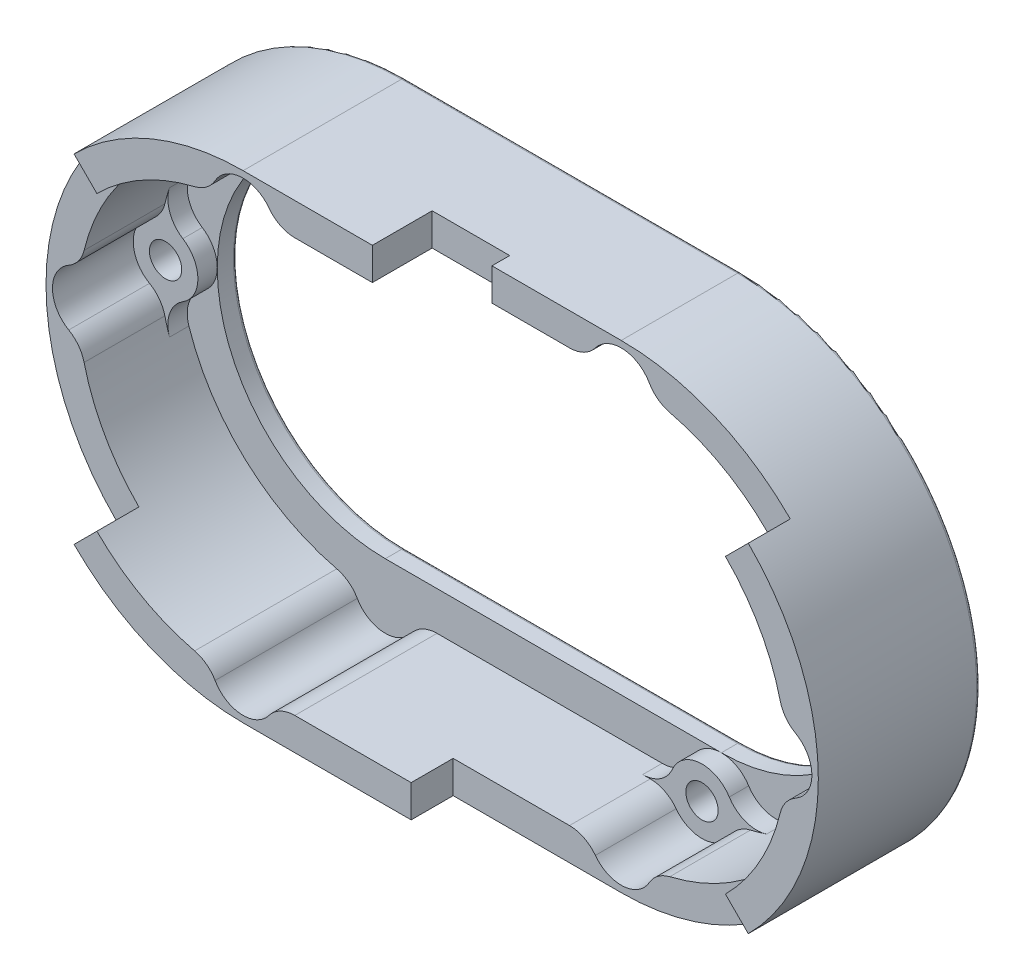
from build123d import *

# Parameters (mm, degrees)
BOSS_EXTRUDE1_DEPTH = 25
SKETCH1_3_R         = 5
BOSS_EXTRUDE2_DEPTH = 3
SKETCH2_W           = 12
SKETCH2_H           = 18.5
CUT_EXTRUDE1_DEPTH  = 5
BOSS_EXTRUDE3_START = 3
SKETCH1_4_R         = 5
SKETCH1_4_R_2       = 2.5
BOSS_EXTRUDE3_DEPTH = 3
FILLET2_R           = 5
FILLET3_R           = 5
FILLET1_R           = 0.5
CUT_EXTRUDE3_START  = 1.5
SKETCH1_6_R         = 2.5
CUT_EXTRUDE3_DEPTH  = 1.5
CUT_EXTRUDE4_START  = -6.5
CUT_EXTRUDE4_DEPTH  = 6.5


with BuildPart() as part:
    # Sketch1 → Boss-Extrude1 (new body)
    with BuildSketch(Plane.XY):
        with BuildLine():
            Line((52, 37), (0, 37))
            ThreePointArc((0, 37), (-37, 0), (0, -37))
            Line((0, -37), (52, -37))
            ThreePointArc((52, -37), (89, 0), (52, 37))
        make_face()
        with BuildLine():
            ThreePointArc((-31.612903226, 4.96229278), (-22.627416998, 22.627416998), (-4.96229278, 31.612903226))
            ThreePointArc((-4.96229278, 31.612903226), (-0.196120171, 35.996152207), (4.898979486, 32))
            Line((4.898979486, 32), (47.101020514, 32))
            ThreePointArc((47.101020514, 32), (52.196120171, 35.996152207), (56.96229278, 31.612903226))
            ThreePointArc((56.96229278, 31.612903226), (74.627416998, 22.627416998), (83.612903226, 4.96229278))
            ThreePointArc((83.612903226, 4.96229278), (86.745965572, 3.311758134), (88, 0))
            ThreePointArc((88, 0), (86.745965572, -3.311758134), (83.612903226, -4.96229278))
            ThreePointArc((83.612903226, -4.96229278), (74.627416998, -22.627416998), (56.96229278, -31.612903226))
            ThreePointArc((56.96229278, -31.612903226), (52.196120171, -35.996152207), (47.101020514, -32))
            Line((47.101020514, -32), (4.898979486, -32))
            ThreePointArc((4.898979486, -32), (-0.196120171, -35.996152207), (-4.96229278, -31.612903226))
            ThreePointArc((-4.96229278, -31.612903226), (-22.627416998, -22.627416998), (-31.612903226, -4.96229278))
            ThreePointArc((-31.612903226, -4.96229278), (-36, 0), (-31.612903226, 4.96229278))
        make_face(mode=Mode.SUBTRACT)
    extrude(amount=BOSS_EXTRUDE1_DEPTH)

    # Sketch1<3> → Boss-Extrude2 (add)
    # profile 1 of 43: a face of its own
    with BuildSketch(Plane.XY):
        with BuildLine():
            Line((0, -37), (52, -37))
            ThreePointArc((52, -37), (89, 0), (52, 37))
            Line((52, 37), (0, 37))
            ThreePointArc((0, 37), (-37, 0), (0, -37))
        make_face()
        with Locations((0, 31)):
            Circle(SKETCH1_3_R, mode=Mode.SUBTRACT)
        with Locations((52, 31)):
            Circle(SKETCH1_3_R, mode=Mode.SUBTRACT)
        with Locations((83, 0)):
            Circle(SKETCH1_3_R, mode=Mode.SUBTRACT)
        with Locations((52, -31)):
            Circle(SKETCH1_3_R, mode=Mode.SUBTRACT)
        with Locations((0, -31)):
            Circle(SKETCH1_3_R, mode=Mode.SUBTRACT)
        with Locations((-31, 0)):
            Circle(SKETCH1_3_R, mode=Mode.SUBTRACT)
        with BuildLine():
            Line((0, 32), (52, 32))
            ThreePointArc((52, 32), (84, 0), (52, -32))
            Line((52, -32), (0, -32))
            ThreePointArc((0, -32), (-32, 0), (0, 32))
        make_face(mode=Mode.SUBTRACT)
    # profile 2 of 43: a face of its own
    with BuildSketch(Plane.XY):
        with BuildLine():
            Line((52, 32), (49.708712153, 32))
            ThreePointArc((49.708712153, 32), (51.489225891, 28.552734218), (54.5, 31))
            ThreePointArc((54.5, 31), (54.456219207, 31.465818858), (54.326410233, 31.915322581))
            ThreePointArc((54.326410233, 31.915322581), (53.16397539, 31.978823638), (52, 32))
        make_face()
    # profile 3 of 43: a face of its own
    with BuildSketch(Plane.XY):
        with BuildLine():
            ThreePointArc((54.326410233, 31.915322581), (52.04583625, 33.499579772), (49.708712153, 32))
            Line((49.708712153, 32), (52, 32))
            ThreePointArc((52, 32), (53.16397539, 31.978823638), (54.326410233, 31.915322581))
        make_face()
    # profile 4 of 43: a face of its own
    with BuildSketch(Plane.XY):
        with BuildLine():
            ThreePointArc((56.96229278, 31.612903226), (52.196120171, 35.996152207), (47.101020514, 32))
            Line((47.101020514, 32), (49.708712153, 32))
            ThreePointArc((49.708712153, 32), (52.04583625, 33.499579772), (54.326410233, 31.915322581))
            ThreePointArc((54.326410233, 31.915322581), (55.647487117, 31.791442838), (56.96229278, 31.612903226))
        make_face()
    # profile 5 of 43: a face of its own
    with BuildSketch(Plane.XY):
        with BuildLine():
            ThreePointArc((47.101020514, 32), (48.127016654, 27.83772234), (52, 26))
            ThreePointArc((52, 26), (55.535533906, 27.464466094), (57, 31))
            ThreePointArc((57, 31), (56.990564292, 31.307031024), (56.96229278, 31.612903226))
            ThreePointArc((56.96229278, 31.612903226), (55.647487117, 31.791442838), (54.326410233, 31.915322581))
            ThreePointArc((54.326410233, 31.915322581), (54.456219207, 31.465818858), (54.5, 31))
            ThreePointArc((54.5, 31), (51.489225891, 28.552734218), (49.708712153, 32))
            Line((49.708712153, 32), (47.101020514, 32))
        make_face()
    # profile 6 of 43: a face of its own
    with BuildSketch(Plane.XY):
        with BuildLine():
            Line((52, 32), (49.708712153, 32))
            ThreePointArc((49.708712153, 32), (51.489225891, 28.552734218), (54.5, 31))
            ThreePointArc((54.5, 31), (54.456219207, 31.465818858), (54.326410233, 31.915322581))
            ThreePointArc((54.326410233, 31.915322581), (53.16397539, 31.978823638), (52, 32))
        make_face()
    # profile 7 of 43: a face of its own
    with BuildSketch(Plane.XY):
        with BuildLine():
            ThreePointArc((54.326410233, 31.915322581), (52.04583625, 33.499579772), (49.708712153, 32))
            Line((49.708712153, 32), (52, 32))
            ThreePointArc((52, 32), (53.16397539, 31.978823638), (54.326410233, 31.915322581))
        make_face()
    # profile 8 of 43: a face of its own
    with BuildSketch(Plane.XY):
        with BuildLine():
            ThreePointArc((56.96229278, 31.612903226), (52.196120171, 35.996152207), (47.101020514, 32))
            Line((47.101020514, 32), (49.708712153, 32))
            ThreePointArc((49.708712153, 32), (52.04583625, 33.499579772), (54.326410233, 31.915322581))
            ThreePointArc((54.326410233, 31.915322581), (55.647487117, 31.791442838), (56.96229278, 31.612903226))
        make_face()
    # profile 9 of 43: a face of its own
    with BuildSketch(Plane.XY):
        with BuildLine():
            ThreePointArc((47.101020514, 32), (48.127016654, 27.83772234), (52, 26))
            ThreePointArc((52, 26), (55.535533906, 27.464466094), (57, 31))
            ThreePointArc((57, 31), (56.990564292, 31.307031024), (56.96229278, 31.612903226))
            ThreePointArc((56.96229278, 31.612903226), (55.647487117, 31.791442838), (54.326410233, 31.915322581))
            ThreePointArc((54.326410233, 31.915322581), (54.456219207, 31.465818858), (54.5, 31))
            ThreePointArc((54.5, 31), (51.489225891, 28.552734218), (49.708712153, 32))
            Line((49.708712153, 32), (47.101020514, 32))
        make_face()
    # profile 10 of 43: a face of its own
    with BuildSketch(Plane.XY):
        with BuildLine():
            ThreePointArc((57, 31), (55.535533906, 27.464466094), (52, 26))
            ThreePointArc((52, 26), (70.384776311, 18.384776311), (78, 0))
            ThreePointArc((78, 0), (79.688241866, 3.745965572), (83.612903226, 4.96229278))
            ThreePointArc((83.612903226, 4.96229278), (74.627416998, 22.627416998), (56.96229278, 31.612903226))
            ThreePointArc((56.96229278, 31.612903226), (56.990564292, 31.307031024), (57, 31))
        make_face()
    # profile 11 of 43: a face of its own
    with BuildSketch(Plane.XY):
        with BuildLine():
            ThreePointArc((88, 0), (86.745965572, 3.311758134), (83.612903226, 4.96229278))
            ThreePointArc((83.612903226, 4.96229278), (84, 0), (83.612903226, -4.96229278))
            ThreePointArc((83.612903226, -4.96229278), (86.745965572, -3.311758134), (88, 0))
        make_face()
    # profile 12 of 43: a face of its own
    with BuildSketch(Plane.XY):
        with BuildLine():
            ThreePointArc((83.612903226, 4.96229278), (79.688241866, 3.745965572), (78, 0))
            ThreePointArc((78, 0), (79.688241866, -3.745965572), (83.612903226, -4.96229278))
            ThreePointArc((83.612903226, -4.96229278), (84, 0), (83.612903226, 4.96229278))
        make_face()
    # profile 13 of 43: a face of its own
    with BuildSketch(Plane.XY):
        with BuildLine():
            ThreePointArc((83.612903226, -4.96229278), (79.688241866, -3.745965572), (78, 0))
            ThreePointArc((78, 0), (70.384776311, -18.384776311), (52, -26))
            ThreePointArc((52, -26), (55.535533906, -27.464466094), (57, -31))
            ThreePointArc((57, -31), (56.990564292, -31.307031024), (56.96229278, -31.612903226))
            ThreePointArc((56.96229278, -31.612903226), (74.627416998, -22.627416998), (83.612903226, -4.96229278))
        make_face()
    # profile 14 of 43: a face of its own
    with BuildSketch(Plane.XY):
        with BuildLine():
            Line((49.708712153, -32), (47.101020514, -32))
            ThreePointArc((47.101020514, -32), (52.196120171, -35.996152207), (56.96229278, -31.612903226))
            ThreePointArc((56.96229278, -31.612903226), (55.647487117, -31.791442838), (54.326410233, -31.915322581))
            ThreePointArc((54.326410233, -31.915322581), (52.04583625, -33.499579772), (49.708712153, -32))
        make_face()
    # profile 15 of 43: a face of its own
    with BuildSketch(Plane.XY):
        with BuildLine():
            ThreePointArc((57, -31), (55.535533906, -27.464466094), (52, -26))
            ThreePointArc((52, -26), (48.127016654, -27.83772234), (47.101020514, -32))
            Line((47.101020514, -32), (49.708712153, -32))
            ThreePointArc((49.708712153, -32), (51.489225891, -28.552734218), (54.5, -31))
            ThreePointArc((54.5, -31), (54.456219207, -31.465818858), (54.326410233, -31.915322581))
            ThreePointArc((54.326410233, -31.915322581), (55.647487117, -31.791442838), (56.96229278, -31.612903226))
            ThreePointArc((56.96229278, -31.612903226), (56.990564292, -31.307031024), (57, -31))
        make_face()
    # profile 16 of 43: a face of its own
    with BuildSketch(Plane.XY):
        with BuildLine():
            Line((52, -32), (49.708712153, -32))
            ThreePointArc((49.708712153, -32), (52.04583625, -33.499579772), (54.326410233, -31.915322581))
            ThreePointArc((54.326410233, -31.915322581), (53.16397539, -31.978823638), (52, -32))
        make_face()
    # profile 17 of 43: a face of its own
    with BuildSketch(Plane.XY):
        with BuildLine():
            ThreePointArc((54.5, -31), (51.489225891, -28.552734218), (49.708712153, -32))
            Line((49.708712153, -32), (52, -32))
            ThreePointArc((52, -32), (53.16397539, -31.978823638), (54.326410233, -31.915322581))
            ThreePointArc((54.326410233, -31.915322581), (54.456219207, -31.465818858), (54.5, -31))
        make_face()
    # profile 18 of 43: a face of its own
    with BuildSketch(Plane.XY):
        with BuildLine():
            Line((52, -26), (0, -26))
            ThreePointArc((0, -26), (3.535533906, -27.464466094), (5, -31))
            ThreePointArc((5, -31), (4.974680765, -31.50254481), (4.898979486, -32))
            Line((4.898979486, -32), (47.101020514, -32))
            ThreePointArc((47.101020514, -32), (48.127016654, -27.83772234), (52, -26))
        make_face()
    # profile 19 of 43: a face of its own
    with BuildSketch(Plane.XY):
        with BuildLine():
            ThreePointArc((0, -32), (-2.488684067, -31.90307903), (-4.96229278, -31.612903226))
            ThreePointArc((-4.96229278, -31.612903226), (-0.196120171, -35.996152207), (4.898979486, -32))
            Line((4.898979486, -32), (0, -32))
        make_face()
    # profile 20 of 43: a face of its own
    with BuildSketch(Plane.XY):
        with BuildLine():
            ThreePointArc((5, -31), (3.535533906, -27.464466094), (0, -26))
            ThreePointArc((0, -26), (-3.745965572, -27.688241866), (-4.96229278, -31.612903226))
            ThreePointArc((-4.96229278, -31.612903226), (-2.488684067, -31.90307903), (0, -32))
            Line((0, -32), (4.898979486, -32))
            ThreePointArc((4.898979486, -32), (4.974680765, -31.50254481), (5, -31))
        make_face()
    # profile 21 of 43: a face of its own
    with BuildSketch(Plane.XY):
        with BuildLine():
            ThreePointArc((0, -26), (-18.384776311, -18.384776311), (-26, 0))
            ThreePointArc((-26, 0), (-27.688241866, -3.745965572), (-31.612903226, -4.96229278))
            ThreePointArc((-31.612903226, -4.96229278), (-22.627416998, -22.627416998), (-4.96229278, -31.612903226))
            ThreePointArc((-4.96229278, -31.612903226), (-3.745965572, -27.688241866), (0, -26))
        make_face()
    # profile 22 of 43: a face of its own
    with BuildSketch(Plane.XY):
        with BuildLine():
            ThreePointArc((-31.915322581, -2.326410233), (-32, 0), (-31.915322581, 2.326410233))
            ThreePointArc((-31.915322581, 2.326410233), (-33.5, 0), (-31.915322581, -2.326410233))
        make_face()
    # profile 23 of 43: a face of its own
    with BuildSketch(Plane.XY):
        with BuildLine():
            ThreePointArc((-28.5, 0), (-29.592574416, 2.06619293), (-31.915322581, 2.326410233))
            ThreePointArc((-31.915322581, 2.326410233), (-32, 0), (-31.915322581, -2.326410233))
            ThreePointArc((-31.915322581, -2.326410233), (-29.592574416, -2.06619293), (-28.5, 0))
        make_face()
    # profile 24 of 43: a face of its own
    with BuildSketch(Plane.XY):
        with BuildLine():
            ThreePointArc((-31.915322581, 2.326410233), (-31.791442838, 3.647487117), (-31.612903226, 4.96229278))
            ThreePointArc((-31.612903226, 4.96229278), (-36, 0), (-31.612903226, -4.96229278))
            ThreePointArc((-31.612903226, -4.96229278), (-31.791442838, -3.647487117), (-31.915322581, -2.326410233))
            ThreePointArc((-31.915322581, -2.326410233), (-33.5, 0), (-31.915322581, 2.326410233))
        make_face()
    # profile 25 of 43: a face of its own
    with BuildSketch(Plane.XY):
        with BuildLine():
            ThreePointArc((-31.612903226, -4.96229278), (-27.688241866, -3.745965572), (-26, 0))
            ThreePointArc((-26, 0), (-27.688241866, 3.745965572), (-31.612903226, 4.96229278))
            ThreePointArc((-31.612903226, 4.96229278), (-31.791442838, 3.647487117), (-31.915322581, 2.326410233))
            ThreePointArc((-31.915322581, 2.326410233), (-29.592574416, 2.06619293), (-28.5, 0))
            ThreePointArc((-28.5, 0), (-29.592574416, -2.06619293), (-31.915322581, -2.326410233))
            ThreePointArc((-31.915322581, -2.326410233), (-31.791442838, -3.647487117), (-31.612903226, -4.96229278))
        make_face()
    # profile 26 of 43: a face of its own
    with BuildSketch(Plane.XY):
        with BuildLine():
            ThreePointArc((-26, 0), (-18.384776311, 18.384776311), (0, 26))
            ThreePointArc((0, 26), (-3.745965572, 27.688241866), (-4.96229278, 31.612903226))
            ThreePointArc((-4.96229278, 31.612903226), (-22.627416998, 22.627416998), (-31.612903226, 4.96229278))
            ThreePointArc((-31.612903226, 4.96229278), (-27.688241866, 3.745965572), (-26, 0))
        make_face()
    # profile 27 of 43: a face of its own
    with BuildSketch(Plane.XY):
        with BuildLine():
            ThreePointArc((4.898979486, 32), (-0.196120171, 35.996152207), (-4.96229278, 31.612903226))
            ThreePointArc((-4.96229278, 31.612903226), (-2.488684067, 31.90307903), (0, 32))
            Line((0, 32), (4.898979486, 32))
        make_face()
    # profile 28 of 43: a face of its own
    with BuildSketch(Plane.XY):
        with BuildLine():
            ThreePointArc((-4.96229278, 31.612903226), (-3.745965572, 27.688241866), (0, 26))
            ThreePointArc((0, 26), (3.535533906, 27.464466094), (5, 31))
            ThreePointArc((5, 31), (4.974680765, 31.50254481), (4.898979486, 32))
            Line((4.898979486, 32), (0, 32))
            ThreePointArc((0, 32), (-2.488684067, 31.90307903), (-4.96229278, 31.612903226))
        make_face()
    # profile 29 of 43: a face of its own
    with BuildSketch(Plane.XY):
        with BuildLine():
            ThreePointArc((5, 31), (3.535533906, 27.464466094), (0, 26))
            Line((0, 26), (52, 26))
            ThreePointArc((52, 26), (48.127016654, 27.83772234), (47.101020514, 32))
            Line((47.101020514, 32), (4.898979486, 32))
            ThreePointArc((4.898979486, 32), (4.974680765, 31.50254481), (5, 31))
        make_face()
    # profile 30 of 43: a face of its own
    with BuildSketch(Plane.XY):
        with BuildLine():
            ThreePointArc((-4.96229278, 31.612903226), (-3.745965572, 27.688241866), (0, 26))
            ThreePointArc((0, 26), (3.535533906, 27.464466094), (5, 31))
            ThreePointArc((5, 31), (4.974680765, 31.50254481), (4.898979486, 32))
            Line((4.898979486, 32), (0, 32))
            ThreePointArc((0, 32), (-2.488684067, 31.90307903), (-4.96229278, 31.612903226))
        make_face()
    # profile 31 of 43: a face of its own
    with BuildSketch(Plane.XY):
        with BuildLine():
            ThreePointArc((4.898979486, 32), (-0.196120171, 35.996152207), (-4.96229278, 31.612903226))
            ThreePointArc((-4.96229278, 31.612903226), (-2.488684067, 31.90307903), (0, 32))
            Line((0, 32), (4.898979486, 32))
        make_face()
    # profile 32 of 43: a face of its own
    with BuildSketch(Plane.XY):
        with BuildLine():
            ThreePointArc((-31.612903226, -4.96229278), (-27.688241866, -3.745965572), (-26, 0))
            ThreePointArc((-26, 0), (-27.688241866, 3.745965572), (-31.612903226, 4.96229278))
            ThreePointArc((-31.612903226, 4.96229278), (-31.791442838, 3.647487117), (-31.915322581, 2.326410233))
            ThreePointArc((-31.915322581, 2.326410233), (-29.592574416, 2.06619293), (-28.5, 0))
            ThreePointArc((-28.5, 0), (-29.592574416, -2.06619293), (-31.915322581, -2.326410233))
            ThreePointArc((-31.915322581, -2.326410233), (-31.791442838, -3.647487117), (-31.612903226, -4.96229278))
        make_face()
    # profile 33 of 43: a face of its own
    with BuildSketch(Plane.XY):
        with BuildLine():
            ThreePointArc((-31.915322581, 2.326410233), (-31.791442838, 3.647487117), (-31.612903226, 4.96229278))
            ThreePointArc((-31.612903226, 4.96229278), (-36, 0), (-31.612903226, -4.96229278))
            ThreePointArc((-31.612903226, -4.96229278), (-31.791442838, -3.647487117), (-31.915322581, -2.326410233))
            ThreePointArc((-31.915322581, -2.326410233), (-33.5, 0), (-31.915322581, 2.326410233))
        make_face()
    # profile 34 of 43: a face of its own
    with BuildSketch(Plane.XY):
        with BuildLine():
            ThreePointArc((-28.5, 0), (-29.592574416, 2.06619293), (-31.915322581, 2.326410233))
            ThreePointArc((-31.915322581, 2.326410233), (-32, 0), (-31.915322581, -2.326410233))
            ThreePointArc((-31.915322581, -2.326410233), (-29.592574416, -2.06619293), (-28.5, 0))
        make_face()
    # profile 35 of 43: a face of its own
    with BuildSketch(Plane.XY):
        with BuildLine():
            ThreePointArc((-31.915322581, -2.326410233), (-32, 0), (-31.915322581, 2.326410233))
            ThreePointArc((-31.915322581, 2.326410233), (-33.5, 0), (-31.915322581, -2.326410233))
        make_face()
    # profile 36 of 43: a face of its own
    with BuildSketch(Plane.XY):
        with BuildLine():
            ThreePointArc((57, -31), (55.535533906, -27.464466094), (52, -26))
            ThreePointArc((52, -26), (48.127016654, -27.83772234), (47.101020514, -32))
            Line((47.101020514, -32), (49.708712153, -32))
            ThreePointArc((49.708712153, -32), (51.489225891, -28.552734218), (54.5, -31))
            ThreePointArc((54.5, -31), (54.456219207, -31.465818858), (54.326410233, -31.915322581))
            ThreePointArc((54.326410233, -31.915322581), (55.647487117, -31.791442838), (56.96229278, -31.612903226))
            ThreePointArc((56.96229278, -31.612903226), (56.990564292, -31.307031024), (57, -31))
        make_face()
    # profile 37 of 43: a face of its own
    with BuildSketch(Plane.XY):
        with BuildLine():
            Line((49.708712153, -32), (47.101020514, -32))
            ThreePointArc((47.101020514, -32), (52.196120171, -35.996152207), (56.96229278, -31.612903226))
            ThreePointArc((56.96229278, -31.612903226), (55.647487117, -31.791442838), (54.326410233, -31.915322581))
            ThreePointArc((54.326410233, -31.915322581), (52.04583625, -33.499579772), (49.708712153, -32))
        make_face()
    # profile 38 of 43: a face of its own
    with BuildSketch(Plane.XY):
        with BuildLine():
            ThreePointArc((54.5, -31), (51.489225891, -28.552734218), (49.708712153, -32))
            Line((49.708712153, -32), (52, -32))
            ThreePointArc((52, -32), (53.16397539, -31.978823638), (54.326410233, -31.915322581))
            ThreePointArc((54.326410233, -31.915322581), (54.456219207, -31.465818858), (54.5, -31))
        make_face()
    # profile 39 of 43: a face of its own
    with BuildSketch(Plane.XY):
        with BuildLine():
            Line((52, -32), (49.708712153, -32))
            ThreePointArc((49.708712153, -32), (52.04583625, -33.499579772), (54.326410233, -31.915322581))
            ThreePointArc((54.326410233, -31.915322581), (53.16397539, -31.978823638), (52, -32))
        make_face()
    # profile 40 of 43: a face of its own
    with BuildSketch(Plane.XY):
        with BuildLine():
            ThreePointArc((83.612903226, 4.96229278), (79.688241866, 3.745965572), (78, 0))
            ThreePointArc((78, 0), (79.688241866, -3.745965572), (83.612903226, -4.96229278))
            ThreePointArc((83.612903226, -4.96229278), (84, 0), (83.612903226, 4.96229278))
        make_face()
    # profile 41 of 43: a face of its own
    with BuildSketch(Plane.XY):
        with BuildLine():
            ThreePointArc((88, 0), (86.745965572, 3.311758134), (83.612903226, 4.96229278))
            ThreePointArc((83.612903226, 4.96229278), (84, 0), (83.612903226, -4.96229278))
            ThreePointArc((83.612903226, -4.96229278), (86.745965572, -3.311758134), (88, 0))
        make_face()
    # profile 42 of 43: a face of its own
    with BuildSketch(Plane.XY):
        with BuildLine():
            ThreePointArc((5, -31), (3.535533906, -27.464466094), (0, -26))
            ThreePointArc((0, -26), (-3.745965572, -27.688241866), (-4.96229278, -31.612903226))
            ThreePointArc((-4.96229278, -31.612903226), (-2.488684067, -31.90307903), (0, -32))
            Line((0, -32), (4.898979486, -32))
            ThreePointArc((4.898979486, -32), (4.974680765, -31.50254481), (5, -31))
        make_face()
    # profile 43 of 43: a face of its own
    with BuildSketch(Plane.XY):
        with BuildLine():
            ThreePointArc((0, -32), (-2.488684067, -31.90307903), (-4.96229278, -31.612903226))
            ThreePointArc((-4.96229278, -31.612903226), (-0.196120171, -35.996152207), (4.898979486, -32))
            Line((4.898979486, -32), (0, -32))
        make_face()
    extrude(amount=BOSS_EXTRUDE2_DEPTH)

    # Sketch2 → Cut-Extrude1 (cut)
    with BuildSketch(Plane(origin=(0, 37, 0), x_dir=(1, 0, 0), z_dir=(0, 1, 0))):
        with Locations((26, -25)):
            Rectangle(SKETCH2_W, SKETCH2_H)
    extrude(amount=-CUT_EXTRUDE1_DEPTH, mode=Mode.SUBTRACT)

    # Sketch1<4> → Boss-Extrude3 (add)
    # profile 1 of 3: a face of its own
    with BuildSketch(Plane.XY.offset(BOSS_EXTRUDE3_START)):
        with Locations((-31, 0)):
            Circle(SKETCH1_4_R)
        with Locations((-31, 0)):
            Circle(SKETCH1_4_R_2, mode=Mode.SUBTRACT)
    # profile 2 of 3: a face of its own
    with BuildSketch(Plane.XY.offset(BOSS_EXTRUDE3_START)):
        with Locations((52, -31)):
            Circle(SKETCH1_4_R)
        with Locations((52, -31)):
            Circle(SKETCH1_4_R_2, mode=Mode.SUBTRACT)
    # profile 3 of 3: a face of its own
    with BuildSketch(Plane.XY.offset(BOSS_EXTRUDE3_START)):
        with Locations((52, 31)):
            Circle(SKETCH1_4_R)
        with Locations((52, 31)):
            Circle(SKETCH1_4_R_2, mode=Mode.SUBTRACT)
    extrude(amount=BOSS_EXTRUDE3_DEPTH)

    # Fillet2
    # the kernel refuses this fillet: 5 mm, written as the material it adds along each edge
    with BuildSketch(Plane(origin=(-31.612903226, -4.96229278, -9.980429616), x_dir=(0.2347067910888954, -0.9720662128768562, 0), z_dir=(0, 0, 1))) as fillet2_piece_1_section:
        with BuildLine():
            CenterArc((4.786533421, 4.983518583), FILLET2_R, 198.802392553, 75.850995491)
            ThreePointArc((0.05335441, 3.371992458), (0.319549613, 1.681362163), (0, 0))
            ThreePointArc((0, 0), (2.596085923, -0.105481068), (5.192171846, 0))
        make_face()
    fillet2_piece_1 = extrude(amount=15.980429616, mode=Mode.PRIVATE)
    fillet2_piece_1 = split(fillet2_piece_1, bisect_by=Plane(origin=(-30.606812106, -6.144779527, 0), z_dir=(0, 0, 1)), keep=Keep.TOP, mode=Mode.PRIVATE)
    add(fillet2_piece_1)
    with BuildSketch(Plane(origin=(-31.612903226, 4.96229278, -9.980429616), x_dir=(0.23470679108889603, 0.9720662128768561, 0), z_dir=(0, 0, 1))) as fillet2_piece_2_section:
        with BuildLine():
            CenterArc((4.786533421, -4.983518583), FILLET2_R, 85.346611956, 75.850995491)
            ThreePointArc((0.05335441, -3.371992458), (0.319549613, -1.681362163), (0, 0))
            ThreePointArc((0, 0), (2.596085923, 0.105481068), (5.192171846, 0))
        make_face()
    fillet2_piece_2 = extrude(amount=15.980429616, mode=Mode.PRIVATE)
    fillet2_piece_2 = split(fillet2_piece_2, bisect_by=Plane(origin=(-30.606812106, 6.144779527, 0), z_dir=(0, 0, 1)), keep=Keep.TOP, mode=Mode.PRIVATE)
    add(fillet2_piece_2)
    with BuildSketch(Plane(origin=(47.101020514, 32, -7.665429761), x_dir=(-1, 0, 0), z_dir=(0, 0, 1))) as fillet2_piece_3_section:
        with BuildLine():
            CenterArc((4.266171904, 5), FILLET2_R, 203.578178478, 66.421821522)
            ThreePointArc((-0.316403791, 3), (0.073441671, 1.524430968), (0, 0))
            Line((0, 0), (4.266171904, 0))
        make_face()
    fillet2_piece_3 = extrude(amount=13.665429761, mode=Mode.PRIVATE)
    fillet2_piece_3 = split(fillet2_piece_3, bisect_by=Plane(origin=(46.060941631, 31.318489549, 0), z_dir=(0, 0, 1)), keep=Keep.TOP, mode=Mode.PRIVATE)
    add(fillet2_piece_3)
    with BuildSketch(Plane(origin=(56.96229278, 31.612903226, -9.980429616), x_dir=(0.972066212876856, -0.23470679108889672, 0), z_dir=(0, 0, 1))) as fillet2_piece_4_section:
        with BuildLine():
            CenterArc((4.786533421, -4.983518583), FILLET2_R, 85.346611956, 75.850995491)
            ThreePointArc((0.05335441, -3.371992458), (0.319549613, -1.681362163), (0, 0))
            ThreePointArc((0, 0), (2.596085923, 0.105481068), (5.192171846, 0))
        make_face()
    fillet2_piece_4 = extrude(amount=15.980429616, mode=Mode.PRIVATE)
    fillet2_piece_4 = split(fillet2_piece_4, bisect_by=Plane(origin=(58.144779527, 30.606812106, 0), z_dir=(0, 0, 1)), keep=Keep.TOP, mode=Mode.PRIVATE)
    add(fillet2_piece_4)
    with BuildSketch(Plane(origin=(56.96229278, -31.612903226, -9.980429616), x_dir=(0.9720662128768561, 0.23470679108889575, 0), z_dir=(0, 0, 1))) as fillet2_piece_5_section:
        with BuildLine():
            CenterArc((4.786533421, 4.983518583), FILLET2_R, 198.802392553, 75.850995491)
            ThreePointArc((0.05335441, 3.371992458), (0.319549613, 1.681362163), (0, 0))
            ThreePointArc((0, 0), (2.596085923, -0.105481068), (5.192171846, 0))
        make_face()
    fillet2_piece_5 = extrude(amount=15.980429616, mode=Mode.PRIVATE)
    fillet2_piece_5 = split(fillet2_piece_5, bisect_by=Plane(origin=(58.144779527, -30.606812106, 0), z_dir=(0, 0, 1)), keep=Keep.TOP, mode=Mode.PRIVATE)
    add(fillet2_piece_5)
    with BuildSketch(Plane(origin=(47.101020514, -32, -7.665429761), x_dir=(-1, 0, 0), z_dir=(0, 0, 1))) as fillet2_piece_6_section:
        with BuildLine():
            CenterArc((4.266171904, -5), FILLET2_R, 90, 66.421821522)
            ThreePointArc((-0.316403791, -3), (0.073441671, -1.524430968), (0, 0))
            Line((0, 0), (4.266171904, 0))
        make_face()
    fillet2_piece_6 = extrude(amount=13.665429761, mode=Mode.PRIVATE)
    fillet2_piece_6 = split(fillet2_piece_6, bisect_by=Plane(origin=(46.060941631, -31.318489549, 0), z_dir=(0, 0, 1)), keep=Keep.TOP, mode=Mode.PRIVATE)
    add(fillet2_piece_6)

    # Fillet3
    fillet3_edges = [part.edges().sort_by_distance(p)[0] for p in [
        (-4.96229278, 31.612903226, 14),
        (-31.612903226, 4.96229278, 15.5),
        (-31.612903226, -4.96229278, 15.5),
        (-4.96229278, -31.612903226, 14),
        (4.898979486, -32, 14),
        (47.101020514, -32, 15.5),
        (56.96229278, -31.612903226, 15.5),
        (83.612903226, -4.96229278, 14),
        (83.612903226, 4.96229278, 14),
        (56.96229278, 31.612903226, 15.5),
        (47.101020514, 32, 15.5),
        (4.898979486, 32, 14),
    ]]
    fillet(fillet3_edges, radius=FILLET3_R)

    # Fillet1
    fillet1_edges = [part.edges().sort_by_distance(p)[0] for p in [
        (-37, 0, 0),
        (26, 37, 0),
        (89, 0, 0),
        (26, -37, 0),
        (-26, 0, 0),
        (26, -26, 0),
        (78, 0, 0),
        (26, 26, 0),
    ]]
    fillet(fillet1_edges, radius=FILLET1_R)

    # Sketch1<6> → Cut-Extrude3 (cut)
    with BuildSketch(Plane.XY.offset(CUT_EXTRUDE3_START)):
        with Locations((-31, 0)):
            Circle(SKETCH1_6_R)
        with Locations((52, -31)):
            Circle(SKETCH1_6_R)
        with Locations((52, 31)):
            Circle(SKETCH1_6_R)
    extrude(amount=CUT_EXTRUDE3_DEPTH, mode=Mode.SUBTRACT)

    # Sketch3 → Cut-Extrude4 (cut)
    with BuildSketch(Plane.XY.offset(25).offset(CUT_EXTRUDE4_START)):
        with BuildLine():
            ThreePointArc((-31.107236269, 7.505987725), (-27.910887593, 15.651912144), (-22.627416998, 22.627416998))
            Line((-22.627416998, 22.627416998), (-26.162950904, 26.162950904))
            ThreePointArc((-26.162950904, 26.162950904), (-37, 0), (-26.162950904, -26.162950904))
            Line((-26.162950904, -26.162950904), (-22.627416998, -22.627416998))
            ThreePointArc((-22.627416998, -22.627416998), (-27.910887593, -15.651912144), (-31.107236269, -7.505987725))
            ThreePointArc((-31.107236269, -7.505987725), (-31.968768588, -5.677429925), (-33.483870968, -4.339399154))
            ThreePointArc((-33.483870968, -4.339399154), (-36, 0), (-33.483870968, 4.339399154))
            ThreePointArc((-33.483870968, 4.339399154), (-31.968768588, 5.677429925), (-31.107236269, 7.505987725))
        make_face()
        with BuildLine():
            ThreePointArc((59.505987725, 31.107236269), (67.651912144, 27.910887593), (74.627416998, 22.627416998))
            Line((74.627416998, 22.627416998), (78.162950904, 26.162950904))
            ThreePointArc((78.162950904, 26.162950904), (66.159286998, 34.183542703), (52, 37))
            Line((52, 37), (32, 37))
            Line((32, 37), (32, 32))
            Line((32, 32), (44, 32))
            ThreePointArc((44, 32), (46.236067977, 32.527864045), (48, 34))
            ThreePointArc((48, 34), (52.3088612, 35.990451358), (56.339399154, 33.483870968))
            ThreePointArc((56.339399154, 33.483870968), (57.677429925, 31.968768588), (59.505987725, 31.107236269))
        make_face()
        with BuildLine():
            Line((44, -32), (26, -32))
            Line((26, -32), (26, -37))
            Line((26, -37), (52, -37))
            ThreePointArc((52, -37), (66.159286998, -34.183542703), (78.162950904, -26.162950904))
            Line((78.162950904, -26.162950904), (74.627416998, -22.627416998))
            ThreePointArc((74.627416998, -22.627416998), (67.651912144, -27.910887593), (59.505987725, -31.107236269))
            ThreePointArc((59.505987725, -31.107236269), (57.677429925, -31.968768588), (56.339399154, -33.483870968))
            ThreePointArc((56.339399154, -33.483870968), (52.3088612, -35.990451358), (48, -34))
            ThreePointArc((48, -34), (46.236067977, -32.527864045), (44, -32))
        make_face()
    extrude(amount=CUT_EXTRUDE4_DEPTH, mode=Mode.SUBTRACT)


solid = part.part
